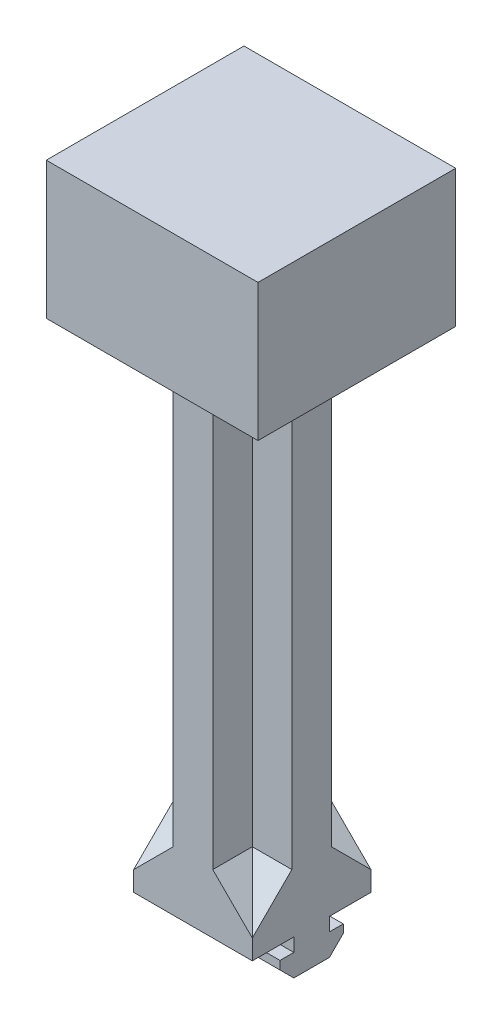
from build123d import *

# Parameters (mm, degrees)
SKETCH1_W           = 34
SKETCH1_H           = 22
BOSS_EXTRUDE1_DEPTH = 31.75
SHELL1_T            = -3.5
BOSS_EXTRUDE2_DEPTH = 76.2
BOSS_EXTRUDE3_START = 26.525
BOSS_EXTRUDE3_DEPTH = 19.05
CHAMFER1_SIZE       = 6.35


with BuildPart() as part:
    # Sketch1 → Boss-Extrude1 (new body)
    with BuildSketch(Plane.XY):
        with Locations((17, 11)):
            Rectangle(SKETCH1_W, SKETCH1_H)
    extrude(amount=BOSS_EXTRUDE1_DEPTH)

    # Shell1
    shell1_openings = [part.faces().sort_by_distance(p)[0] for p in [
        (17, 11, 0),
    ]]
    offset(amount=SHELL1_T, openings=shell1_openings, kind=Kind.INTERSECTION)

    # Sketch2 → Boss-Extrude2 (add)
    with BuildSketch(Plane.XZ):
        Polygon((13.825, 25.189889706), (13.825, 18.839889706), (7.475, 18.839889706), (7.475, 12.489889706), (13.825, 12.489889706), (13.825, 6.139889706), (20.175, 6.139889706), (20.175, 12.489889706), (26.525, 12.489889706), (26.525, 18.839889706), (20.175, 18.839889706), (20.175, 25.189889706), align=None)
    extrude(amount=BOSS_EXTRUDE2_DEPTH)

    # Sketch3 → Boss-Extrude3 (add)
    with BuildSketch(Plane(origin=(0, 0, 0), x_dir=(0, 0, -1), z_dir=(1, 0, 0)).offset(BOSS_EXTRUDE3_START)):
        Polygon((-10.584889706, -81.534), (-10.584889706, -82.8675), (-12.807389706, -85.09), (-18.522389706, -85.09), (-20.744889706, -82.8675), (-20.744889706, -81.534), (-18.522389706, -81.534), (-18.522389706, -79.375), (-25.189889706, -79.375), (-25.189889706, -76.2), (-6.139889706, -76.2), (-6.139889706, -79.375), (-12.807389706, -79.375), (-12.807389706, -81.534), align=None)
    extrude(amount=-BOSS_EXTRUDE3_DEPTH)

    # Chamfer1
    # the kernel refuses this chamfer: 6.35 mm, written as the material it adds along each edge
    with BuildSketch(Plane(origin=(30.155186974, -76.2, 18.839889706), x_dir=(0, -0.027495876610585664, 0.9996219169112966), z_dir=(-1, 0, 0))) as chamfer1_piece_1_section:
        Polygon((CHAMFER1_SIZE * 0.999621916911, CHAMFER1_SIZE * 0.0274958766106), (-CHAMFER1_SIZE * 0.0274958766106, CHAMFER1_SIZE * 0.999621916911), (0, 0), align=None)
    chamfer1_piece_1 = extrude(amount=22.680186974, mode=Mode.PRIVATE)
    chamfer1_piece_1 = split(chamfer1_piece_1, bisect_by=Plane(origin=(26.525, -74.083333333, 20.956556373), z_dir=(-1, 0, 0)), keep=Keep.TOP, mode=Mode.PRIVATE)
    add(chamfer1_piece_1)
    with BuildSketch(Plane(origin=(13.825, -76.2, 25.189889706), x_dir=(-0.9996219169112966, -0.027495876610585654, 0), z_dir=(0, 0, -1))) as chamfer1_piece_2_section:
        Polygon((CHAMFER1_SIZE * 0.999621916911, CHAMFER1_SIZE * 0.0274958766106), (-CHAMFER1_SIZE * 0.0274958766106, CHAMFER1_SIZE * 0.999621916911), (0, 0), align=None)
    chamfer1_piece_2 = extrude(amount=22.680186974, mode=Mode.PRIVATE)
    chamfer1_piece_2 = split(chamfer1_piece_2, bisect_by=Plane(origin=(11.708333333, -74.083333333, 6.139889706), z_dir=(0, 0, 1)), keep=Keep.TOP, mode=Mode.PRIVATE)
    add(chamfer1_piece_2)
    with BuildSketch(Plane(origin=(26.525, -76.2, 18.839889706), x_dir=(0, -0.027495876610585654, 0.9996219169112968), z_dir=(-1, 0, 0))) as chamfer1_piece_3_section:
        Polygon((CHAMFER1_SIZE * 0.999621916911, CHAMFER1_SIZE * 0.0274958766106), (-CHAMFER1_SIZE * 0.0274958766106, CHAMFER1_SIZE * 0.999621916911), (0, 0), align=None)
    chamfer1_piece_3 = extrude(amount=22.680186974, mode=Mode.PRIVATE)
    chamfer1_piece_3 = split(chamfer1_piece_3, bisect_by=Plane(origin=(7.475, -74.083333333, 20.956556373), z_dir=(1, 0, 0)), keep=Keep.TOP, mode=Mode.PRIVATE)
    add(chamfer1_piece_3)
    with BuildSketch(Plane(origin=(20.175, -76.2, 2.509702732), x_dir=(0.9996219169112966, -0.02749587661058565, 0), z_dir=(0, 0, 1))) as chamfer1_piece_4_section:
        Polygon((CHAMFER1_SIZE * 0.999621916911, CHAMFER1_SIZE * 0.0274958766106), (-CHAMFER1_SIZE * 0.0274958766106, CHAMFER1_SIZE * 0.999621916911), (0, 0), align=None)
    chamfer1_piece_4 = extrude(amount=22.680186974, mode=Mode.PRIVATE)
    chamfer1_piece_4 = split(chamfer1_piece_4, bisect_by=Plane(origin=(22.291666667, -74.083333333, 6.139889706), z_dir=(0, 0, 1)), keep=Keep.TOP, mode=Mode.PRIVATE)
    add(chamfer1_piece_4)
    with BuildSketch(Plane(origin=(3.844813026, -76.2, 12.489889706), x_dir=(0, -0.027495876610585654, -0.9996219169112966), z_dir=(1, 0, 0))) as chamfer1_piece_5_section:
        Polygon((CHAMFER1_SIZE * 0.999621916911, CHAMFER1_SIZE * 0.0274958766106), (-CHAMFER1_SIZE * 0.0274958766106, CHAMFER1_SIZE * 0.999621916911), (0, 0), align=None)
    chamfer1_piece_5 = extrude(amount=22.680186974, mode=Mode.PRIVATE)
    chamfer1_piece_5 = split(chamfer1_piece_5, bisect_by=Plane(origin=(7.475, -74.083333333, 10.373223039), z_dir=(1, 0, 0)), keep=Keep.TOP, mode=Mode.PRIVATE)
    add(chamfer1_piece_5)
    with BuildSketch(Plane(origin=(20.175, -76.2, 6.139889706), x_dir=(0.9996219169112966, -0.02749587661058565, 0), z_dir=(0, 0, 1))) as chamfer1_piece_6_section:
        Polygon((CHAMFER1_SIZE * 0.999621916911, CHAMFER1_SIZE * 0.0274958766106), (-CHAMFER1_SIZE * 0.0274958766106, CHAMFER1_SIZE * 0.999621916911), (0, 0), align=None)
    chamfer1_piece_6 = extrude(amount=22.680186974, mode=Mode.PRIVATE)
    chamfer1_piece_6 = split(chamfer1_piece_6, bisect_by=Plane(origin=(22.291666667, -74.083333333, 25.189889706), z_dir=(0, 0, -1)), keep=Keep.TOP, mode=Mode.PRIVATE)
    add(chamfer1_piece_6)
    with BuildSketch(Plane(origin=(7.475, -76.2, 12.489889706), x_dir=(0, -0.027495876610585654, -0.9996219169112966), z_dir=(1, 0, 0))) as chamfer1_piece_7_section:
        Polygon((CHAMFER1_SIZE * 0.999621916911, CHAMFER1_SIZE * 0.0274958766106), (-CHAMFER1_SIZE * 0.0274958766106, CHAMFER1_SIZE * 0.999621916911), (0, 0), align=None)
    chamfer1_piece_7 = extrude(amount=22.680186974, mode=Mode.PRIVATE)
    chamfer1_piece_7 = split(chamfer1_piece_7, bisect_by=Plane(origin=(26.525, -74.083333333, 10.373223039), z_dir=(-1, 0, 0)), keep=Keep.TOP, mode=Mode.PRIVATE)
    add(chamfer1_piece_7)
    with BuildSketch(Plane(origin=(13.825, -76.2, 28.820076679), x_dir=(-0.9996219169112966, -0.02749587661058566, 0), z_dir=(0, 0, -1))) as chamfer1_piece_8_section:
        Polygon((CHAMFER1_SIZE * 0.999621916911, CHAMFER1_SIZE * 0.0274958766106), (-CHAMFER1_SIZE * 0.0274958766106, CHAMFER1_SIZE * 0.999621916911), (0, 0), align=None)
    chamfer1_piece_8 = extrude(amount=22.680186974, mode=Mode.PRIVATE)
    chamfer1_piece_8 = split(chamfer1_piece_8, bisect_by=Plane(origin=(11.708333333, -74.083333333, 25.189889706), z_dir=(0, 0, -1)), keep=Keep.TOP, mode=Mode.PRIVATE)
    add(chamfer1_piece_8)
    with BuildSketch(Plane(origin=(13.825, 0, 25.189889706), x_dir=(-0.9996219169112966, 0.02749587661058637, 0), z_dir=(0, 0, -1))) as chamfer1_piece_9_section:
        Polygon((CHAMFER1_SIZE * 0.999621916911, -CHAMFER1_SIZE * 0.0274958766106), (-CHAMFER1_SIZE * 0.0274958766106, -CHAMFER1_SIZE * 0.999621916911), (0, 0), align=None)
    chamfer1_piece_9 = extrude(amount=22.680186974, mode=Mode.PRIVATE)
    chamfer1_piece_9 = split(chamfer1_piece_9, bisect_by=Plane(origin=(11.708333333, -2.116666667, 6.139889706), z_dir=(0, 0, 1)), keep=Keep.TOP, mode=Mode.PRIVATE)
    add(chamfer1_piece_9)
    with BuildSketch(Plane(origin=(30.155186974, 0, 18.839889706), x_dir=(0, 0.027495876610586382, 0.9996219169112966), z_dir=(-1, 0, 0))) as chamfer1_piece_10_section:
        Polygon((CHAMFER1_SIZE * 0.999621916911, -CHAMFER1_SIZE * 0.0274958766106), (-CHAMFER1_SIZE * 0.0274958766106, -CHAMFER1_SIZE * 0.999621916911), (0, 0), align=None)
    chamfer1_piece_10 = extrude(amount=22.680186974, mode=Mode.PRIVATE)
    chamfer1_piece_10 = split(chamfer1_piece_10, bisect_by=Plane(origin=(26.525, -2.116666667, 20.956556373), z_dir=(-1, 0, 0)), keep=Keep.TOP, mode=Mode.PRIVATE)
    add(chamfer1_piece_10)
    with BuildSketch(Plane(origin=(26.525, 0, 18.839889706), x_dir=(0, -0.9996219169112966, -0.0274958766105862), z_dir=(-1, 0, 0))) as chamfer1_piece_11_section:
        Polygon((CHAMFER1_SIZE * 0.999621916911, CHAMFER1_SIZE * 0.0274958766106), (-CHAMFER1_SIZE * 0.0274958766106, CHAMFER1_SIZE * 0.999621916911), (0, 0), align=None)
    chamfer1_piece_11 = extrude(amount=22.680186974, mode=Mode.PRIVATE)
    chamfer1_piece_11 = split(chamfer1_piece_11, bisect_by=Plane(origin=(7.475, -2.116666667, 20.956556373), z_dir=(1, 0, 0)), keep=Keep.TOP, mode=Mode.PRIVATE)
    add(chamfer1_piece_11)
    with BuildSketch(Plane(origin=(20.175, 0, 2.509702732), x_dir=(-0.0274958766105862, -0.9996219169112966, 0), z_dir=(0, 0, 1))) as chamfer1_piece_12_section:
        Polygon((CHAMFER1_SIZE * 0.999621916911, CHAMFER1_SIZE * 0.0274958766106), (-CHAMFER1_SIZE * 0.0274958766106, CHAMFER1_SIZE * 0.999621916911), (0, 0), align=None)
    chamfer1_piece_12 = extrude(amount=22.680186974, mode=Mode.PRIVATE)
    chamfer1_piece_12 = split(chamfer1_piece_12, bisect_by=Plane(origin=(22.291666667, -2.116666667, 6.139889706), z_dir=(0, 0, 1)), keep=Keep.TOP, mode=Mode.PRIVATE)
    add(chamfer1_piece_12)
    with BuildSketch(Plane(origin=(20.175, 0, 6.139889706), x_dir=(0.9996219169112966, 0.027495876610586365, 0), z_dir=(0, 0, 1))) as chamfer1_piece_13_section:
        Polygon((CHAMFER1_SIZE * 0.999621916911, -CHAMFER1_SIZE * 0.0274958766106), (-CHAMFER1_SIZE * 0.0274958766106, -CHAMFER1_SIZE * 0.999621916911), (0, 0), align=None)
    chamfer1_piece_13 = extrude(amount=22.680186974, mode=Mode.PRIVATE)
    chamfer1_piece_13 = split(chamfer1_piece_13, bisect_by=Plane(origin=(22.291666667, -2.116666667, 25.189889706), z_dir=(0, 0, -1)), keep=Keep.TOP, mode=Mode.PRIVATE)
    add(chamfer1_piece_13)
    with BuildSketch(Plane(origin=(3.844813026, 0, 12.489889706), x_dir=(0, -0.9996219169112966, 0.02749587661058647), z_dir=(1, 0, 0))) as chamfer1_piece_14_section:
        Polygon((CHAMFER1_SIZE * 0.999621916911, CHAMFER1_SIZE * 0.0274958766106), (-CHAMFER1_SIZE * 0.0274958766106, CHAMFER1_SIZE * 0.999621916911), (0, 0), align=None)
    chamfer1_piece_14 = extrude(amount=22.680186974, mode=Mode.PRIVATE)
    chamfer1_piece_14 = split(chamfer1_piece_14, bisect_by=Plane(origin=(7.475, -2.116666667, 10.373223039), z_dir=(1, 0, 0)), keep=Keep.TOP, mode=Mode.PRIVATE)
    add(chamfer1_piece_14)
    with BuildSketch(Plane(origin=(13.825, 0, 28.820076679), x_dir=(-0.9996219169112966, 0.02749587661058637, 0), z_dir=(0, 0, -1))) as chamfer1_piece_15_section:
        Polygon((CHAMFER1_SIZE * 0.999621916911, -CHAMFER1_SIZE * 0.0274958766106), (-CHAMFER1_SIZE * 0.0274958766106, -CHAMFER1_SIZE * 0.999621916911), (0, 0), align=None)
    chamfer1_piece_15 = extrude(amount=22.680186974, mode=Mode.PRIVATE)
    chamfer1_piece_15 = split(chamfer1_piece_15, bisect_by=Plane(origin=(11.708333333, -2.116666667, 25.189889706), z_dir=(0, 0, -1)), keep=Keep.TOP, mode=Mode.PRIVATE)
    add(chamfer1_piece_15)
    with BuildSketch(Plane(origin=(7.475, 0, 12.489889706), x_dir=(0, 0.02749587661058637, -0.9996219169112966), z_dir=(1, 0, 0))) as chamfer1_piece_16_section:
        Polygon((CHAMFER1_SIZE * 0.999621916911, -CHAMFER1_SIZE * 0.0274958766106), (-CHAMFER1_SIZE * 0.0274958766106, -CHAMFER1_SIZE * 0.999621916911), (0, 0), align=None)
    chamfer1_piece_16 = extrude(amount=22.680186974, mode=Mode.PRIVATE)
    chamfer1_piece_16 = split(chamfer1_piece_16, bisect_by=Plane(origin=(26.525, -2.116666667, 10.373223039), z_dir=(-1, 0, 0)), keep=Keep.TOP, mode=Mode.PRIVATE)
    add(chamfer1_piece_16)


solid = part.part
